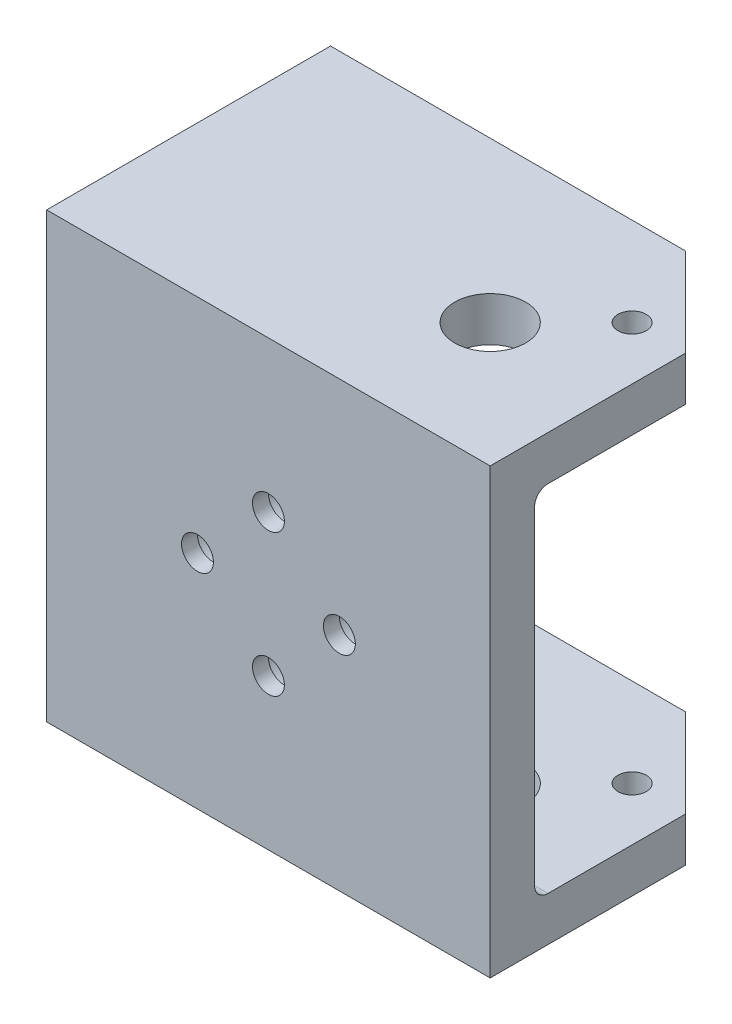
from build123d import *

# Parameters (mm, degrees)
SKETCH1_W                       = 25
SKETCH1_H                       = 25
BOSS_EXTRUDE1_DEPTH             = 2.5
SKETCH2_W                       = 25
SKETCH2_H                       = 2.5
BOSS_EXTRUDE2_DEPTH             = 13.5
SKETCH10_R                      = 2
CUT_EXTRUDE1_DEPTH              = 32.04029639
SKETCH10_3_R                    = 0.8
CUT_EXTRUDE2_DEPTH              = 32.04029639
FILLET1_R                       = 0.762
CHAMFER1_SIZE                   = 5
CBORE_FOR_M1_6_SHCS1_AT_2_COUNT = 2
CBORE_FOR_M1_6_SHCS1_AT_2_PITCH = 8
CBORE_FOR_M1_6_SHCS1_AT_3_COUNT = 2
CBORE_FOR_M1_6_SHCS1_AT_3_PITCH = 5.656854249
CBORE_FOR_M1_6_SHCS1_AT_4_COUNT = 2
CBORE_FOR_M1_6_SHCS1_AT_4_PITCH = 5.656854249


with BuildPart() as part:
    # Sketch1 → Boss-Extrude1 (new body)
    with BuildSketch(Plane.XY):
        Rectangle(SKETCH1_W, SKETCH1_H)
    extrude(amount=BOSS_EXTRUDE1_DEPTH)

    # Sketch2 → Boss-Extrude2 (add)
    with BuildSketch(Plane(origin=(0, 0, 0), x_dir=(-1, 0, 0), z_dir=(0, 0, -1))):
        with Locations((0, 11.25)):
            Rectangle(SKETCH2_W, SKETCH2_H)
        with Locations((0, -11.25)):
            Rectangle(SKETCH2_W, SKETCH2_H)
    extrude(amount=BOSS_EXTRUDE2_DEPTH)

    # Sketch10 → Cut-Extrude1 (cut, through all)
    with BuildSketch(Plane.XZ.offset(12.5)):
        with Locations((5.5, -4.5)):
            Circle(SKETCH10_R)
    extrude(amount=-CUT_EXTRUDE1_DEPTH, mode=Mode.SUBTRACT)

    # Sketch10<3> → Cut-Extrude2 (cut, through all)
    with BuildSketch(Plane.XZ.offset(12.5)):
        with Locations((9.5, -8.5)):
            Circle(SKETCH10_3_R)
    extrude(amount=-CUT_EXTRUDE2_DEPTH, mode=Mode.SUBTRACT)

    # Fillet1
    fillet1_edges = [part.edges().sort_by_distance(p)[0] for p in [
        (0, -10, 0),
        (0, 10, 0),
    ]]
    fillet(fillet1_edges, radius=FILLET1_R)

    # Chamfer1
    chamfer1_edges = [part.edges().sort_by_distance(p)[0] for p in [
        (12.5, -11.25, -13.5),
        (12.5, 11.25, -13.5),
    ]]
    chamfer(chamfer1_edges, length=CHAMFER1_SIZE)

    # Sketch14 → CBORE for M1.6 SHCS1 (revolve, cut)
    with BuildSketch(Plane(origin=(0, 4, 0), x_dir=(0, 1, 0), z_dir=(1, 0, 0))):
        Polygon((0, 0), (0, 2.5), (0.9, 2.5), (0.9, 1.6), (1.75, 1.6), (1.75, 0.025), (1.775, 0), align=None)
    cbore_for_m1_6_shcs1 = revolve(axis=Axis((0, 4, -6.35), (0, 0, 1)), mode=Mode.SUBTRACT)

    # CBORE for M1.6 SHCS1 at 2: CBORE for M1.6 SHCS1 ×2
    with Locations(*[(0, -i * CBORE_FOR_M1_6_SHCS1_AT_2_PITCH, 0) for i in range(1, CBORE_FOR_M1_6_SHCS1_AT_2_COUNT)]):
        add(cbore_for_m1_6_shcs1, mode=Mode.SUBTRACT)

    # CBORE for M1.6 SHCS1 at 3: CBORE for M1.6 SHCS1 ×2
    with Locations(*[Vector(-0.7071067811865476, -0.7071067811865476, 0) * (i * CBORE_FOR_M1_6_SHCS1_AT_3_PITCH) for i in range(1, CBORE_FOR_M1_6_SHCS1_AT_3_COUNT)]):
        add(cbore_for_m1_6_shcs1, mode=Mode.SUBTRACT)

    # CBORE for M1.6 SHCS1 at 4: CBORE for M1.6 SHCS1 ×2
    with Locations(*[Vector(0.7071067811865476, -0.7071067811865476, 0) * (i * CBORE_FOR_M1_6_SHCS1_AT_4_PITCH) for i in range(1, CBORE_FOR_M1_6_SHCS1_AT_4_COUNT)]):
        add(cbore_for_m1_6_shcs1, mode=Mode.SUBTRACT)


solid = part.part
